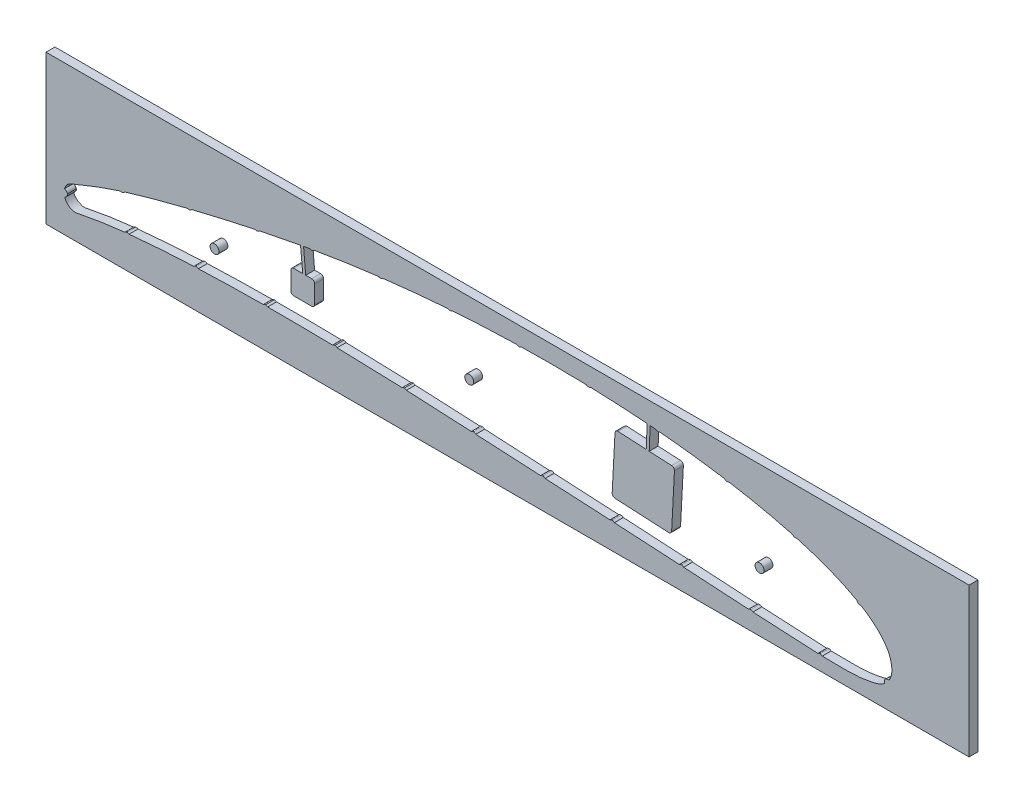
from build123d import *

# Parameters (mm, degrees)
BOSS_EXTRUDE1_DEPTH   = 3
BOSS_EXTRUDE2_START   = -3
BOSS_EXTRUDE2_DEPTH   = 3
SKETCH4_R             = 1.4999999999999973
BOSS_EXTRUDE3_DEPTH   = 3
SKETCH4_R_2           = 1.5000000000000042
BOSS_EXTRUDE3_2_DEPTH = 3
BOSS_EXTRUDE3_3_DEPTH = 3


# Read off the part's stored shape, not the designer's step: Boss-Extrude2
with BuildPart() as part:
    # Sketch1 → Boss-Extrude1 (new body)
    with BuildSketch(Plane.XY):
        Polygon((-280.0617418301615, 37.712423785622505), (29.938258169838473, 37.7124237856225), (29.938258169838473, -12.287576214377504), (-280.0617418301615, -12.287576214377504), align=None)
        with BuildLine():
            Line((-190.85404601252725, 16.42727857338892), (-192.85404601252725, 16.42727857338892))
            Line((-192.85404601252725, 16.42727857338892), (-193.56999025434837, 24.480551718674327))
            add(Edge.make_bspline(
                [(-78.16840229223553, 30.63963948980569), (-87.80030941925838, 31.39681210993548), (-107.13401239689482, 32.18560766949166), (-136.0930810232918, 31.481633705928775), (-164.9544487001638, 29.022939125560843), (-184.07172457220736, 26.20309686334219), (-193.56999025434837, 24.480551718674327)],
                knots=[1.6477548367984183, 1.6477548367984183, 1.6477548367984183, 1.6477548367984183, 1.6996663252520494, 1.7515778137056806, 1.8034893021593117, 1.8554007906129428, 1.8554007906129428, 1.8554007906129428, 1.8554007906129428], degree=3))
            Line((-78.16840229223553, 30.63963948980569), (-78.4845223782321, 22.97210189607874))
            Line((-78.4845223782321, 22.97210189607874), (-87.92724203547814, 23.466973863707263))
            ThreePointArc((-87.92724203547814, 23.466973863707263), (-88.64870859807996, 23.211489154430083), (-88.97820752647567, 22.520680285195617))
            Line((-88.97820752647567, 22.520680285195617), (-89.92025473884853, 4.545348659613297))
            ThreePointArc((-89.92025473884853, 4.545348659613297), (-89.66477002957134, 3.823882097011495), (-88.97396116033688, 3.494383168615778))
            Line((-88.97396116033688, 3.494383168615778), (-70.99862953475457, 2.5523359562429175))
            ThreePointArc((-70.99862953475457, 2.5523359562429175), (-70.27716297215275, 2.8078206655200972), (-69.94766404375704, 3.4986295347545613))
            Line((-69.94766404375704, 3.4986295347545613), (-69.00561683138419, 21.47396116033688))
            ThreePointArc((-69.00561683138419, 21.47396116033688), (-69.26110154066137, 22.195427722938685), (-69.95191040989583, 22.524926651334404))
            Line((-69.95191040989583, 22.524926651334404), (-77.4845223782321, 22.91969411679571))
            Line((-77.4845223782321, 22.91969411679571), (-77.16310914016181, 30.55927119660944))
            add(Edge.make_bspline(
                [(-194.5743095444694, 24.297269390822514), (-199.0748890517499, 23.470863661167208), (-205.81218343544447, 22.139157809968406), (-214.75288090409586, 20.223529664485483), (-221.44184547392086, 18.71753563279187), (-228.11693846055658, 17.14206305979209), (-234.77567096371374, 15.494484020866787), (-240.31508171522344, 14.05418905000995), (-244.73810418609548, 12.8534265772918), (-248.05215780318545, 11.926479525625448), (-251.3640208235326, 10.966189116297997), (-254.68649735568172, 9.959954418264767), (-257.45988509545435, 9.059228283146444), (-259.6716267225222, 8.293544814859066), (-261.33336410003346, 7.692530283221519), (-262.98230076620973, 7.070477522479272), (-264.33818764061704, 6.539016787168009), (-265.3953192907491, 6.114518853258316), (-266.1832796791735, 5.795988454908996), (-266.97496802169627, 5.47593747683827), (-267.65195977672204, 5.204859909516149), (-268.20628948332626, 4.98332878595608), (-268.6185029927296, 4.818019900431631), (-269.0225749894355, 4.6547236984236156), (-269.4122752051434, 4.495507264263548), (-269.7243657476736, 4.364985345125088), (-269.92309585994366, 4.2821706486608715), (-270.06076373007846, 4.2260210894879116), (-270.19701346339133, 4.172194247781482), (-270.32010101961635, 4.125477566910118), (-270.43002258555094, 4.085160419387649), (-270.51941636642897, 4.053100726716109), (-270.6171247260642, 4.018840772265524), (-270.72350598492636, 3.9823323762832925), (-270.8223781822498, 3.949161299520075), (-270.9136811926323, 3.9187853903684693), (-270.98441756859506, 3.8952682566444152), (-271.0568325003071, 3.871109210160312), (-271.11838393534987, 3.850397201137166), (-271.16951776098983, 3.832977249460483), (-271.2095694827856, 3.81918287874423), (-271.252580079772, 3.804152169023424), (-271.3007888879636, 3.78697811807259), (-271.358522686942, 3.7658383305933416), (-271.421390696716, 3.7419743664061893), (-271.49095631245234, 3.714203536040945), (-271.5583295787348, 3.6862228299848674), (-271.65057692934727, 3.6457521278101903), (-271.7632753497447, 3.5927551043819848), (-271.8973514066723, 3.523261462487154), (-272.0316486730558, 3.4479858053621113), (-272.21920562829763, 3.3324783950047716), (-272.4954821562871, 3.134573919883896), (-272.85931785098944, 2.822492809551407), (-273.2837762254473, 2.3100549258288705), (-273.6626243945065, 1.6839586524699874), (-274.0187116795929, 0.6541527094059202), (-274.0162602971361, -0.8703604662462496), (-273.3546225011884, -2.3343764565069676), (-272.4745363968785, -3.1948294470080008), (-271.75661576946095, -3.6147299051913437), (-271.05457494240915, -3.8817356495365187), (-270.53190733625905, -3.9722292542347484), (-270.1642868291065, -4.001044215917756), (-269.9283856239212, -4.001609075647538), (-269.765297648604, -3.9949407704258477), (-269.6068181202841, -3.982942324219433), (-269.4778581736112, -3.967902026239612), (-269.3745812943166, -3.9530110222631367), (-269.3004200420359, -3.9407564967247346), (-269.2435721303145, -3.930536688081123), (-269.1826924502828, -3.9188947999632857), (-269.12485023843107, -3.9070265924112095), (-269.0695158140851, -3.8950810045915367), (-269.0218688168142, -3.8844170850465796), (-268.96404119082587, -3.8711437137440523), (-268.8975836025596, -3.855456896794041), (-268.8205994085969, -3.836915433473535), (-268.74478919280375, -3.8184406861870017), (-268.6703879140166, -3.8002105622526745), (-268.5740015410013, -3.776574306036677), (-268.46717899002033, -3.7505705481462357), (-268.3488200669596, -3.7223586925498546), (-268.23880183797763, -3.6966651903242695), (-268.10233087941305, -3.665494967206004), (-267.94852603799256, -3.6316079123244216), (-267.7825546057743, -3.5967574407219995), (-267.62581626618567, -3.5653176155046133), (-267.46828775991787, -3.5348715184886412), (-267.2465807685956, -3.4930651573789486), (-266.9226341732447, -3.431922119663937), (-266.5214041731854, -3.354049432590619), (-266.10572327669064, -3.2726313443397763), (-265.5402011314822, -3.1616036682079907), (-264.8214238439404, -3.021611711934076), (-263.99367170737486, -2.867628602767552), (-263.1839732169304, -2.726103825311811), (-262.3830507382953, -2.5937667572254792), (-261.31781254569455, -2.426876736369115), (-259.9640305262372, -2.2281949909661), (-258.31294525393116, -2.002086295993872), (-256.6494474343612, -1.7901025551921959), (-254.98554574294013, -1.5927512671584272), (-252.76757245784253, -1.3477364853166023), (-249.987058348716, -1.0705881367590935), (-246.6336103841868, -0.7733760389183101), (-243.27270449029865, -0.509628046619367), (-238.78605580082444, -0.19864801214201266), (-233.16609331409865, 0.12061262145655369), (-226.40770416564095, 0.4099457957394287), (-219.6409974305319, 0.6172832021801229), (-210.60959601469463, 0.7958452189616317), (-199.30768541310152, 0.8552834373873816), (-185.7359143752275, 0.7083797596130299), (-172.15604567215414, 0.38097213388069745), (-158.58673324590427, -0.11710391005057878), (-145.0029011669094, -0.7723747117351506), (-131.3958455448103, -1.482797556251551), (-117.77735451369875, -2.197693634859276), (-104.16448083689467, -2.89327816853622), (-90.5643059170212, -3.615592446787772), (-76.96433147303938, -4.377332016687901), (-65.63288183697718, -5.040407740872196), (-56.563986209305334, -5.583697962569699), (-49.760516885635845, -5.992074850417291), (-42.95438613588708, -6.399782214151546), (-36.1389575058422, -6.795837307315924), (-30.45298061506581, -7.106644458306446), (-25.892695982787046, -7.332624670911473), (-22.463665767564862, -7.485779825138317), (-19.02113089300096, -7.612276652905124), (-15.549982104986235, -7.698666678535811), (-12.631902800294844, -7.71412412426893), (-10.256832898947584, -7.668057387737792), (-8.465050648208665, -7.59623202861059), (-6.601672963446198, -7.4683247757037545), (-4.6364057147132165, -7.223812352826307), (-3.216701323927118, -6.945941209187427), (-2.2864097099203073, -6.735317082701022), (-1.6945609127187742, -6.595138378681285), (-0.6839362442424346, -6.337658257128273), (0.6690111623862112, -5.7561977936554065), (1.787762078987277, -4.941451917304406), (2.547009172153864, -4.181714651685778), (3.2307351132803386, -3.234368940714876), (3.7636906379309925, -1.9927406687871774), (3.9742615993221575, -0.8806498869069416), (4.024538669451995, 0.37359905694986956), (3.9071257556829373, 1.4599571486406802), (3.634952651842351, 2.80041077741748), (3.1637804620331376, 4.117266957517159), (2.578275598026579, 5.270786237173809), (1.9470466000706335, 6.269428432436176), (1.0821118324543675, 7.45284803875332), (-0.09055921274926745, 8.7879648860098), (-1.5633301875628152, 10.184419433669486), (-3.620085613492676, 11.858695265092178), (-6.2491588857312115, 13.61158591285965), (-9.445794562628143, 15.418961559826556), (-12.72424494292546, 17.0078422711169), (-17.12699446216591, 18.871445873424623), (-22.66990731977071, 20.848839581091173), (-29.395963321820027, 22.84687381664959), (-36.15503451552397, 24.539683469092598), (-42.94830453573294, 25.992941200625584), (-52.03694604506786, 27.649250651173617), (-63.43772368587336, 29.27690283758347), (-72.5819677482583, 30.186902908935796), (-77.16310914016181, 30.55927119660944)],
                knots=[0.8572308268196556, 0.8572308268196556, 0.8572308268196556, 0.8572308268196556, 0.8818783191278569, 0.8942020652819576, 0.9065258114360581, 0.9188495575901588, 0.9311733037442596, 0.9434970498983601, 0.9496589229754104, 0.9558207960524608, 0.9619826691295112, 0.9681445422065615, 0.9743064152836118, 0.977387351822137, 0.9804682883606621, 0.9835492248991873, 0.9866301614377124, 0.988170629706975, 0.9897110979762376, 0.9912515662455001, 0.9927920345147628, 0.9935622686493941, 0.9943325027840255, 0.9951027369186568, 0.9958729710532881, 0.9966432051879194, 0.997028322255235, 0.9974134393225507, 0.9977985563898664, 0.998183673457182, 0.9983762319908398, 0.9985687905244975, 0.9987613490581554, 0.9989539075918132, 0.9991464661254711, 0.9992427453923001, 0.9993390246591289, 0.9994353039259578, 0.9995315831927867, 0.9995797228262011, 0.9996278624596155, 0.99967600209303, 0.9997241417264445, 0.9997722813598591, 0.9998204209932735, 0.9998444908099807, 0.9998685606266879, 0.9998926304433952, 0.9999167002601024, 0.999928735168456, 0.9999407700768096, 0.9999528049851631, 0.9999648398935168, 0.9999768748018705, 0.9999828922560472, 0.999988909710224, 0.9999949271644009, 1.0000009446185776, 1.0000069620727543, 1.0000129795269312, 1.0000189969811082, 1.000025014435285, 1.0000370493436384, 1.000049084251992, 1.0000611191603457, 1.0000731540686993, 1.000085188977053, 1.0001092587937601, 1.0001333286104672, 1.0001573984271745, 1.0001814682438819, 1.0002055380605892, 1.0002536776940036, 1.000301817327418, 1.0003499569608325, 1.000398096594247, 1.0004943758610758, 1.0005906551279047, 1.0006869343947336, 1.0007832136615624, 1.0008794929283915, 1.0010720514620495, 1.0012646099957072, 1.001457168529365, 1.0016497270630227, 1.0020348441303384, 1.002419961197654, 1.0028050782649696, 1.0031901953322853, 1.003575312399601, 1.0043455465342324, 1.0051157806688635, 1.0058860148034947, 1.006656248938126, 1.008196717207389, 1.0097371854766515, 1.011277653745914, 1.0128181220151766, 1.0143585902844392, 1.0174395268229643, 1.0205204633614895, 1.0236013999000146, 1.0266823364385398, 1.029763272977065, 1.0359251460541152, 1.0420870191311655, 1.0482488922082158, 1.0544107652852661, 1.0667345114393667, 1.0790582575934675, 1.0913820037475683, 1.103705749901669, 1.12835324220987, 1.1530007345180715, 1.177648226826273, 1.202295719134474, 1.2269432114426755, 1.2515907037508769, 1.276238196059078, 1.3008856883672795, 1.3255331806754809, 1.350180672983682, 1.3748281652918835, 1.3871519114459843, 1.3994756576000849, 1.4117994037541854, 1.424123149908286, 1.4364468960623866, 1.442608769139437, 1.4487706422164874, 1.454932515293538, 1.4610943883705882, 1.4672562614476385, 1.4703371979861637, 1.4734181345246888, 1.476499071063214, 1.4795800076017391, 1.4826609441402643, 1.4834311782748957, 1.4842014124095269, 1.4857418806787894, 1.487282348948052, 1.4880525830826832, 1.4888228172173146, 1.489593051351946, 1.4903632854865771, 1.4911335196212083, 1.4919037537558397, 1.4934442220251023, 1.4949846902943649, 1.4965251585636274, 1.49806562683289, 1.4996060951021526, 1.5011465633714152, 1.5042274999099403, 1.5073084364484655, 1.5103893729869906, 1.516551246064041, 1.5227131191410914, 1.528874992218142, 1.5350368652951922, 1.5473606114492928, 1.5596843576033934, 1.572008103757494, 1.5843318499115946, 1.5966555960656954, 1.6213030883738968, 1.645950580682098, 1.645950580682098, 1.645950580682098, 1.645950580682098], degree=3))
            Line((-194.5743095444694, 24.297269390822514), (-193.85404601252725, 16.42727857338892))
            Line((-193.85404601252725, 16.42727857338892), (-196.85404601252725, 16.42727857338892))
            ThreePointArc((-196.85404601252725, 16.42727857338892), (-197.5611527937138, 16.134385354575468), (-197.85404601252725, 15.427278573388922))
            Line((-197.85404601252725, 15.427278573388922), (-197.85404601252725, 9.427278573388922))
            ThreePointArc((-197.85404601252725, 9.427278573388922), (-197.5611527937138, 8.720171792202374), (-196.85404601252725, 8.427278573388923))
            Line((-196.85404601252725, 8.427278573388923), (-190.85404601252725, 8.427278573388923))
            ThreePointArc((-190.85404601252725, 8.427278573388923), (-190.1469392313407, 8.720171792202375), (-189.85404601252725, 9.427278573388923))
            Line((-189.85404601252725, 9.427278573388923), (-189.85404601252725, 15.427278573388923))
            ThreePointArc((-189.85404601252725, 15.427278573388923), (-190.1469392313407, 16.13438535457547), (-190.85404601252725, 16.42727857338892))
        make_face(mode=Mode.SUBTRACT)
    extrude(amount=BOSS_EXTRUDE1_DEPTH)

    # Boss-Extrude2 outline → Boss-Extrude2 (add)
    with BuildSketch(Plane.XY.offset(3).offset(BOSS_EXTRUDE2_START)):
        with BuildLine():
            add(Edge.make_bspline(
                [(-97.136387411, 31.674376095), (-97.61295371581214, 31.689297683779266), (-98.08953831274764, 31.703413237400653), (-98.566136175, 31.716728549)],
                knots=[1.681771325639394, 1.681771325639394, 1.681771325639394, 1.681771325639394, 1.684332397863202, 1.684332397863202, 1.684332397863202, 1.684332397863202], degree=3))
            add(Edge.make_bspline(
                [(-97.847927048, 31.447428217), (-97.9259799156616, 31.4538458937367), (-98.0784436882814, 31.4663817965373), (-98.2974989510406, 31.534969586956), (-98.45567951319626, 31.628367450091428), (-98.54071214162643, 31.695104419447198), (-98.566136175, 31.716728549)],
                knots=[0, 0, 0, 0, 0.127782842821096, 0.249603312684356, 0.371510054284345, 0.4260194405226241, 0.4260194405226241, 0.4260194405226241, 0.4260194405226241], degree=3))
            add(Edge.make_bspline(
                [(-97.136387411, 31.674376095), (-97.15713112005263, 31.658793773201168), (-97.23969457054474, 31.600838299650597), (-97.396358790293, 31.5193565414648), (-97.6167212479199, 31.4538698409591), (-97.7698782251484, 31.4496027351757), (-97.847927048, 31.447428217)],
                knots=[0.5858817165906655, 0.5858817165906655, 0.5858817165906655, 0.5858817165906655, 0.628236714499813, 0.750542171611453, 0.872876245996921, 1, 1, 1, 1], degree=3))
        make_face()
        with BuildLine():
            add(Edge.make_bspline(
                [(-120.402044887, 31.784854773), (-120.89917896158114, 31.774359356162932), (-121.39628330122622, 31.76305631895859), (-121.893356626, 31.750948678)],
                knots=[1.7234551334711954, 1.7234551334711954, 1.7234551334711954, 1.7234551334711954, 1.726128978492673, 1.726128978492673, 1.726128978492673, 1.726128978492673], degree=3))
            add(Edge.make_bspline(
                [(-121.142553557, 31.496137903), (-121.220513611376, 31.4986202182838), (-121.373244455174, 31.5034833002988), (-121.594641087973, 31.5644150399072), (-121.76544420173998, 31.654560669740558), (-121.86037661288606, 31.724072681645893), (-121.893356626, 31.750948678)],
                knots=[0, 0, 0, 0, 0.127392451639903, 0.249573408755608, 0.372137379215552, 0.4417011749006403, 0.4417011749006403, 0.4417011749006403, 0.4417011749006403], degree=3))
            add(Edge.make_bspline(
                [(-120.402044887, 31.784854773), (-120.43432271037392, 31.7560879596119), (-120.52626385315324, 31.68211795606394), (-120.69298165366, 31.5836792724373), (-120.912036916419, 31.5150914820185), (-121.064500689039, 31.502555579218), (-121.142553557, 31.496137903)],
                knots=[0.5578842902215215, 0.5578842902215215, 0.5578842902215215, 0.5578842902215215, 0.628489945715649, 0.750396687315643, 0.872217157178903, 1, 1, 1, 1], degree=3))
        make_face()
        with BuildLine():
            add(Edge.make_bspline(
                [(-143.681748191, 30.712185135), (-144.17626122385727, 30.67719243690044), (-144.67072113634944, 30.64142620360948), (-145.165125946, 30.604886066)],
                knots=[1.7652398965223384, 1.7652398965223384, 1.7652398965223384, 1.7652398965223384, 1.7679064066788306, 1.7679064066788306, 1.7679064066788306, 1.7679064066788306], degree=3))
            add(Edge.make_bspline(
                [(-144.401003061, 30.390339521), (-144.478869441089, 30.3877177175662), (-144.632743547676, 30.3825366932168), (-144.856964515504, 30.4368422498483), (-145.03354959779156, 30.515884881164585), (-145.13133467334663, 30.580112392625995), (-145.165125946, 30.604886066)],
                knots=[0, 0, 0, 0, 0.126566647868366, 0.25011217654809, 0.372266691438683, 0.44048751785488005, 0.44048751785488005, 0.44048751785488005, 0.44048751785488005], degree=3))
            add(Edge.make_bspline(
                [(-143.681748191, 30.712185135), (-143.71080687892407, 30.683906071661372), (-143.79742905411405, 30.607178066846288), (-143.956392417569, 30.5002457491828), (-144.172152344053, 30.420528136313), (-144.323750484409, 30.4005302177787), (-144.401003061, 30.390339521)],
                knots=[0.5625280684611026, 0.5625280684611026, 0.5625280684611026, 0.5625280684611026, 0.628628254765809, 0.75092837255123, 0.873076115111275, 1, 1, 1, 1], degree=3))
        make_face()
        with BuildLine():
            add(Edge.make_bspline(
                [(-166.893769233, 28.494517874), (-167.38675812602415, 28.43509979042218), (-167.87965991651163, 28.374897712125517), (-168.372470596, 28.313909265)],
                knots=[1.8070452791744163, 1.8070452791744163, 1.8070452791744163, 1.8070452791744163, 1.8097152136993053, 1.8097152136993053, 1.8097152136993053, 1.8097152136993053], degree=3))
            add(Edge.make_bspline(
                [(-167.595627005, 28.13337336), (-167.673257563184, 28.1285379962445), (-167.825749458881, 28.1190397550547), (-168.05308326513, 28.1561712133998), (-168.23335613926773, 28.230114513053685), (-168.33626984860075, 28.290125829224365), (-168.372470596, 28.313909265)],
                knots=[0, 0, 0, 0, 0.126824427288464, 0.249124801343794, 0.37251737669549, 0.44319859537325484, 0.44319859537325484, 0.44319859537325484, 0.44319859537325484], degree=3))
            add(Edge.make_bspline(
                [(-166.893769233, 28.494517874), (-166.92244483543138, 28.463365924159387), (-167.00566253960665, 28.381418868175363), (-167.159477780102, 28.2660815374787), (-167.369099328656, 28.1743220937326), (-167.519112601284, 28.1472046409218), (-167.595627005, 28.13337336)],
                knots=[0.560214236006466, 0.560214236006466, 0.560214236006466, 0.560214236006466, 0.629457859730139, 0.750995590744237, 0.872995078296341, 1, 1, 1, 1], degree=3))
        make_face()
        with BuildLine():
            add(Edge.make_bspline(
                [(-189.955621659, 25.120483613), (-189.9833334153857, 25.085759766961445), (-190.06274839784308, 24.996883807243123), (-190.217894516252, 24.879336924793), (-190.420231684646, 24.7729963796171), (-190.568991088299, 24.7390579962081), (-190.644910126, 24.721737616)],
                knots=[0.5556155818396276, 0.5556155818396276, 0.5556155818396276, 0.5556155818396276, 0.628320406023017, 0.750705447741691, 0.872773067903594, 1, 1, 1, 1], degree=3))
            add(Edge.make_bspline(
                [(-189.955621659, 25.120483613), (-190.44621075800563, 25.03572443525705), (-190.93664923108884, 24.95013972915232), (-191.426933037, 24.863727102)],
                knots=[1.8488213671958689, 1.8488213671958689, 1.8488213671958689, 1.8488213671958689, 1.8514984357921291, 1.8514984357921291, 1.8514984357921291, 1.8514984357921291], degree=3))
            add(Edge.make_bspline(
                [(-190.644910126, 24.721737616), (-190.722407106348, 24.7131566506311), (-190.873950177605, 24.696376824377), (-191.101904499436, 24.7222367153785), (-191.2852154424134, 24.78583374273427), (-191.3898352227602, 24.841507017909187), (-191.426933037, 24.863727102)],
                knots=[0, 0, 0, 0, 0.127553848187648, 0.249427808075142, 0.372548445681958, 0.4433552900996293, 0.4433552900996293, 0.4433552900996293, 0.4433552900996293], degree=3))
        make_face()
        with BuildLine():
            add(Edge.make_bspline(
                [(-208.418523105, 21.570264143), (-208.90591988518085, 21.468238612364758), (-209.39315131862327, 21.365660141141696), (-209.88022536, 21.262529998)],
                knots=[0.8825659275468849, 0.8825659275468849, 0.8825659275468849, 0.8825659275468849, 0.8852494460079405, 0.8852494460079405, 0.8852494460079405, 0.8852494460079405], degree=3))
            add(Edge.make_bspline(
                [(-209.091369974, 21.149010721), (-209.168779794244, 21.1373630581861), (-209.320650099682, 21.1145115123109), (-209.55014815359, 21.1361171239742), (-209.73584225383735, 21.191830209485673), (-209.8426326515424, 21.242278417431912), (-209.88022536, 21.262529998)],
                knots=[0, 0, 0, 0, 0.127082175794656, 0.249322485419255, 0.371648062466495, 0.4410602958550294, 0.4410602958550294, 0.4410602958550294, 0.4410602958550294], degree=3))
            add(Edge.make_bspline(
                [(-208.418523105, 21.570264143), (-208.44382124656593, 21.536805195838816), (-208.51899119366675, 21.44713838013116), (-208.666752889102, 21.3231154621555), (-208.866541551671, 21.2083609304335), (-209.015312792749, 21.1690882963112), (-209.091369974, 21.149010721)],
                knots=[0.5598196340876198, 0.5598196340876198, 0.5598196340876198, 0.5598196340876198, 0.628065151560934, 0.750197634553813, 0.872292093734125, 1, 1, 1, 1], degree=3))
        make_face()
        with BuildLine():
            add(Edge.make_bspline(
                [(-231.146011274, 16.389208346), (-231.6283120119689, 16.27006437783441), (-232.11050166323673, 16.150322158060554), (-232.592588638, 16.029966872)],
                knots=[0.9244568075424074, 0.9244568075424074, 0.9244568075424074, 0.9244568075424074, 0.92713418202752, 0.92713418202752, 0.92713418202752, 0.92713418202752], degree=3))
            add(Edge.make_bspline(
                [(-231.804440009, 15.94870586), (-231.880771646825, 15.9330685089663), (-232.030746478438, 15.9023445624497), (-232.260364214307, 15.9167299757324), (-232.44778114649284, 15.963622163785864), (-232.55515372430764, 16.011054061285428), (-232.592588638, 16.029966872)],
                knots=[0, 0, 0, 0, 0.126623505446785, 0.248787259717305, 0.371596684215639, 0.4398977247786833, 0.4398977247786833, 0.4398977247786833, 0.4398977247786833], degree=3))
            add(Edge.make_bspline(
                [(-231.146011274, 16.389208346), (-231.17019469384877, 16.35502056021889), (-231.24249673822163, 16.26323571193985), (-231.385144590859, 16.1335837600601), (-231.581803743428, 16.0138987946396), (-231.729260042278, 15.9707202551747), (-231.804440009, 15.94870586)],
                knots=[0.5604601976170126, 0.5604601976170126, 0.5604601976170126, 0.5604601976170126, 0.62859830452586, 0.750475750894662, 0.872781122356896, 1, 1, 1, 1], degree=3))
        make_face()
        with BuildLine():
            add(Edge.make_bspline(
                [(-253.632077556, 10.275199234), (-253.98374956915166, 10.16712284712126), (-254.4667022344429, 10.017240924056846), (-254.94983182636096, 9.864996182824086), (-255.08104751, 9.823471079)],
                knots=[0.9661883584369809, 0.9661883584369809, 0.9661883584369809, 0.9661883584369809, 0.968144542206562, 0.9688738723966996, 0.9688738723966996, 0.9688738723966996, 0.9688738723966996], degree=3))
            add(Edge.make_bspline(
                [(-254.269328358, 9.779733172), (-254.344496696283, 9.75955209807818), (-254.492143149146, 9.71991221784498), (-254.722372112337, 9.71869011937871), (-254.91895136917324, 9.759143032327652), (-255.03590023340217, 9.803340652955304), (-255.08104751, 9.823471079)],
                knots=[0, 0, 0, 0, 0.126756561465877, 0.248976592832816, 0.37210972039602, 0.45275644150048355, 0.45275644150048355, 0.45275644150048355, 0.45275644150048355], degree=3))
            add(Edge.make_bspline(
                [(-253.632077556, 10.275199234), (-253.6570120431113, 10.23367409868002), (-253.72585174232398, 10.132163736332037), (-253.864006469393, 9.98988121940454), (-254.051945760047, 9.8590748222205), (-254.195838238706, 9.80655605178704), (-254.269328358, 9.779733172)],
                knots=[0.5503367590470254, 0.5503367590470254, 0.5503367590470254, 0.5503367590470254, 0.629378035023054, 0.750448308026975, 0.872546613545376, 1, 1, 1, 1], degree=3))
        make_face()
        with BuildLine():
            add(Edge.make_bspline(
                [(-273.8592452, 1.058223698), (-273.90005124773444, 0.9094113494517186), (-274.01823216018676, 0.3559398985984736), (-274.0168724912144, -0.48963736208441516), (-273.8439682313241, -1.1094817941529422), (-273.803547579, -1.231704773)],
                knots=[0.9999924409658777, 0.9999924409658777, 0.9999924409658777, 0.9999924409658777, 0.999994927164401, 1.00000094461858, 1.0000024537801304, 1.0000024537801304, 1.0000024537801304, 1.0000024537801304], degree=3))
            add(Edge.make_bspline(
                [(-272.879868761, 0.055492793), (-272.873836698747, -0.0221355412146379), (-272.861989857141, -0.174595933412285), (-272.900120004113, -0.401907453965553), (-272.986687285455, -0.614630513324422), (-273.113195403942, -0.809601365213865), (-273.269909687755, -0.980518615501814), (-273.458042763639, -1.11200154915021), (-273.6385693165876, -1.1950564494587177), (-273.75773917345896, -1.2226037204814904), (-273.803547579, -1.231704773)],
                knots=[0, 0, 0, 0, 0.12694988369067, 0.249326862427979, 0.372796726578387, 0.499994819844512, 0.627605522894743, 0.749322060258416, 0.873169797868121, 0.9494091925942163, 0.9494091925942163, 0.9494091925942163, 0.9494091925942163], degree=3))
            add(Edge.make_bspline(
                [(-273.8592452, 1.058223698), (-273.81654026152023, 1.051845462304401), (-273.7014046745361, 1.0272209803434271), (-273.517152971225, 0.958182424753495), (-273.3218378415, 0.832551205610876), (-273.152051205025, 0.674378780196078), (-273.016009465324, 0.490947353131219), (-272.920079663311, 0.282758293793162), (-272.893428374837, 0.132129532109247), (-272.879868761, 0.055492793)],
                knots=[0.18064310513091356, 0.18064310513091356, 0.18064310513091356, 0.18064310513091356, 0.251206314764848, 0.372321806929586, 0.500998339129022, 0.628797770286969, 0.750347802189032, 0.872982224071579, 1, 1, 1, 1], degree=3))
        make_face()
        with BuildLine():
            add(Edge.make_bspline(
                [(-253.605161581, -1.441416738), (-253.51063105189013, -1.4311975854204135), (-253.0324602603461, -1.3798052428253549), (-252.5538911357192, -1.32985428037125), (-252.169660259, -1.290630022)],
                knots=[1.0292383835791172, 1.0292383835791172, 1.0292383835791172, 1.0292383835791172, 1.02976327297706, 1.031893117530192, 1.031893117530192, 1.031893117530192, 1.031893117530192], degree=3))
            add(Edge.make_bspline(
                [(-252.914892582, -1.112408146), (-252.837181169717, -1.10823418215935), (-252.684187428851, -1.10001672245455), (-252.459025892361, -1.14375442052538), (-252.28997998690707, -1.2162818778580218), (-252.1976443845446, -1.2720912523390975), (-252.169660259, -1.290630022)],
                knots=[0, 0, 0, 0, 0.127054460462842, 0.250137483808484, 0.371533833523254, 0.42641602707033427, 0.42641602707033427, 0.42641602707033427, 0.42641602707033427], degree=3))
            add(Edge.make_bspline(
                [(-253.605161581, -1.441416738), (-253.58167145508293, -1.4176880836117904), (-253.50217534687175, -1.3435417716787963), (-253.351526147522, -1.23830443801319), (-253.14161778621, -1.14686695142176), (-252.991474207453, -1.12404739621611), (-252.914892582, -1.112408146)],
                knots=[0.5735997485120303, 0.5735997485120303, 0.5735997485120303, 0.5735997485120303, 0.628320677175065, 0.751714188845252, 0.873360345578502, 1, 1, 1, 1], degree=3))
        make_face()
        with BuildLine():
            add(Edge.make_bspline(
                [(-230.434519304, 0.23331898), (-229.921796247256, 0.2560308503321542), (-229.40896985779023, 0.27797378439406045), (-228.896052164, 0.299170956)],
                knots=[1.0717143702336078, 1.0717143702336078, 1.0717143702336078, 1.0717143702336078, 1.0745199635773452, 1.0745199635773452, 1.0745199635773452, 1.0745199635773452], degree=3))
            add(Edge.make_bspline(
                [(-229.661922006, 0.561354145), (-229.583922738289, 0.56009966654291), (-229.43105558782, 0.55764107327452), (-229.209297419993, 0.494981887662709), (-229.03200896392207, 0.403987929413702), (-228.93274256244638, 0.32993763851118835), (-228.896052164, 0.299170956)],
                knots=[0, 0, 0, 0, 0.127014630790295, 0.248930089964494, 0.372584368106906, 0.4506853228629117, 0.4506853228629117, 0.4506853228629117, 0.4506853228629117], degree=3))
            add(Edge.make_bspline(
                [(-230.434519304, 0.23331898), (-230.39283669221845, 0.27474326584868114), (-230.2912729117171, 0.36348575426542457), (-230.109991401269, 0.469120191221674), (-229.892257735516, 0.543699612452009), (-229.740117099818, 0.555360728751028), (-229.661922006, 0.561354145)],
                knots=[0.5318770156379437, 0.5318770156379437, 0.5318770156379437, 0.5318770156379437, 0.627656645884799, 0.751562124869786, 0.872311411636283, 1, 1, 1, 1], degree=3))
        make_face()
        with BuildLine():
            add(Edge.make_bspline(
                [(-207.080821604, 0.803347375), (-206.59381676698717, 0.8067411663594959), (-206.10678164001635, 0.8096641445306254), (-205.619718469, 0.81212544)],
                knots=[1.114225320413259, 1.114225320413259, 1.114225320413259, 1.114225320413259, 1.116880984046625, 1.116880984046625, 1.116880984046625, 1.116880984046625], degree=3))
            add(Edge.make_bspline(
                [(-206.350359251, 1.069739514), (-206.272434802818, 1.06504038554307), (-206.11967303196, 1.0558282932195), (-205.897759474988, 0.994345812822027), (-205.7361336906853, 0.9009410986089611), (-205.6473630574855, 0.8346099163457625), (-205.619718469, 0.81212544)],
                knots=[0, 0, 0, 0, 0.127564391899991, 0.250075076958219, 0.372662152162646, 0.43089689497973693, 0.43089689497973693, 0.43089689497973693, 0.43089689497973693], degree=3))
            add(Edge.make_bspline(
                [(-207.080821604, 0.803347375), (-207.05243505895191, 0.8271054668471114), (-206.96339827916114, 0.8951509810831006), (-206.799711241052, 0.986329358430335), (-206.581360923286, 1.05801792051578), (-206.428511125504, 1.06577389563211), (-206.350359251, 1.069739514)],
                knots=[0.5680014811692338, 0.5680014811692338, 0.5680014811692338, 0.5680014811692338, 0.628418465259644, 0.750841937945432, 0.872605853256528, 1, 1, 1, 1], degree=3))
        make_face()
        with BuildLine():
            add(Edge.make_bspline(
                [(-183.834857096, 0.643348432), (-183.3176256952967, 0.633354998715646), (-182.80038234782415, 0.6229715960827177), (-182.283131695, 0.612200671)],
                knots=[1.15644960807312, 1.15644960807312, 1.15644960807312, 1.15644960807312, 1.1592665792656067, 1.1592665792656067, 1.1592665792656067, 1.1592665792656067], degree=3))
            add(Edge.make_bspline(
                [(-183.03593857, 0.92647452), (-182.95780128968, 0.919256435472326), (-182.805883901501, 0.905222768318677), (-182.588314284846, 0.832373714077097), (-182.41584521573222, 0.7290459996852132), (-182.31982355917373, 0.6473199517992176), (-182.283131695, 0.612200671)],
                knots=[0, 0, 0, 0, 0.127987356291147, 0.248837749569901, 0.371530363654609, 0.45444879452205483, 0.45444879452205483, 0.45444879452205483, 0.45444879452205483], degree=3))
            add(Edge.make_bspline(
                [(-183.834857096, 0.643348432), (-183.78833346927144, 0.6844282820859345), (-183.67878592554683, 0.7679376926922031), (-183.48831785498, 0.863224698760973), (-183.266398658943, 0.922020526375958), (-183.113882033068, 0.924968143512184), (-183.03593857, 0.92647452)],
                knots=[0.5272230389604384, 0.5272230389604384, 0.5272230389604384, 0.5272230389604384, 0.628434402092807, 0.751419479671922, 0.87296318287285, 1, 1, 1, 1], degree=3))
        make_face()
        with BuildLine():
            add(Edge.make_bspline(
                [(-160.446566047, -0.06568212), (-159.9784977780695, -0.0848182963598359), (-159.51040974943865, -0.10423810554298402), (-159.042297335, -0.123939062)],
                knots=[1.198914677107866, 1.198914677107866, 1.198914677107866, 1.198914677107866, 1.2014642605483015, 1.2014642605483015, 1.2014642605483015, 1.2014642605483015], degree=3))
            add(Edge.make_bspline(
                [(-159.741787404, 0.142106423), (-159.663650123655, 0.134888338142483), (-159.511732735476, 0.120854670988833), (-159.294163118821, 0.0480056167472528), (-159.14237087157122, -0.04293443442436277), (-159.06268490289236, -0.10653791157396875), (-159.042297335, -0.123939062)],
                knots=[0, 0, 0, 0, 0.127987356291147, 0.248837749569901, 0.371530363654609, 0.41531026934505344, 0.41531026934505344, 0.41531026934505344, 0.41531026934505344], degree=3))
            add(Edge.make_bspline(
                [(-160.446566047, -0.06568212), (-160.4288748193195, -0.05292635558310028), (-160.34849315979483, 0.0016504465111828), (-160.194166688955, 0.0788566014311291), (-159.972247492918, 0.137652429046114), (-159.819730867043, 0.14060004618234), (-159.741787404, 0.142106423)],
                knots=[0.5928277455847756, 0.5928277455847756, 0.5928277455847756, 0.5928277455847756, 0.628434402092806, 0.751419479671922, 0.87296318287285, 1, 1, 1, 1], degree=3))
        make_face()
        with BuildLine():
            add(Edge.make_bspline(
                [(-137.236290314, -1.178699821), (-136.72980424748084, -1.2049819097286127), (-136.22328389699783, -1.231318508915331), (-135.716731999, -1.257697857)],
                knots=[1.2410102665863674, 1.2410102665863674, 1.2410102665863674, 1.2410102665863674, 1.2437626326065714, 1.2437626326065714, 1.2437626326065714, 1.2437626326065714], degree=3))
            add(Edge.make_bspline(
                [(-136.454490165, -0.933886585), (-136.377139884928, -0.941746439816545), (-136.224193630305, -0.957287887309813), (-136.009514997868, -1.03872468891116), (-135.84162822544417, -1.1437969257857734), (-135.7504078237397, -1.2242979249756392), (-135.716731999, -1.257697857)],
                knots=[0, 0, 0, 0, 0.126595037289195, 0.250318896319419, 0.371113004598758, 0.448469583215603, 0.448469583215603, 0.448469583215603, 0.448469583215603], degree=3))
            add(Edge.make_bspline(
                [(-137.236290314, -1.178699821), (-137.1962180880537, -1.146977412306718), (-137.09227099859436, -1.0739706911627318), (-136.909796423955, -0.984988279659699), (-136.685148502163, -0.933224520679115), (-136.532314626261, -0.933663203681073), (-136.454490165, -0.933886585)],
                knots=[0.5439979483735052, 0.5439979483735052, 0.5439979483735052, 0.5439979483735052, 0.627353660942562, 0.750963134980005, 0.873188063375038, 1, 1, 1, 1], degree=3))
        make_face()
        with BuildLine():
            add(Edge.make_bspline(
                [(-113.962864278, -2.391522891), (-113.4549778347411, -2.4176985953961805), (-112.94710726145865, -2.443860919852197), (-112.439254213, -2.470020622)],
                knots=[1.2831454349966838, 1.2831454349966838, 1.2831454349966838, 1.2831454349966838, 1.2859039813743467, 1.2859039813743467, 1.2859039813743467, 1.2859039813743467], degree=3))
            add(Edge.make_bspline(
                [(-113.178531649, -2.144699884), (-113.101181368419, -2.15255973816141), (-112.948235113795, -2.16810118565468), (-112.733556481359, -2.24953798725603), (-112.56506241568233, -2.3549902996993684), (-112.47337772560061, -2.4360577980789206), (-112.439254213, -2.470020622)],
                knots=[0, 0, 0, 0, 0.126595037289188, 0.250318896319414, 0.371113004598754, 0.44963389316790275, 0.44963389316790275, 0.44963389316790275, 0.44963389316790275], degree=3))
            add(Edge.make_bspline(
                [(-113.962864278, -2.391522891), (-113.92202431054503, -2.35903194273924), (-113.81728675864491, -2.285259088451728), (-113.633837907446, -2.19580157800455), (-113.409189985654, -2.14403781902398), (-113.256356109752, -2.14447650202594), (-113.178531649, -2.144699884)],
                knots=[0.5422403215187932, 0.5422403215187932, 0.5422403215187932, 0.5422403215187932, 0.627353660942562, 0.750963134979991, 0.873188063375031, 1, 1, 1, 1], degree=3))
        make_face()
        with BuildLine():
            add(Edge.make_bspline(
                [(-90.673235562, -3.616223159), (-90.63693681511958, -3.618202794753549), (-90.13685302630012, -3.6454818126463184), (-89.63676964407031, -3.672840789858455), (-89.172985689, -3.698281703)],
                knots=[1.3253358274307443, 1.3253358274307443, 1.3253358274307443, 1.3253358274307443, 1.32553318067548, 1.3280547413115675, 1.3280547413115675, 1.3280547413115675, 1.3280547413115675], degree=3))
            add(Edge.make_bspline(
                [(-89.903927195, -3.381178376), (-89.8265769145361, -3.38903823036306), (-89.673630659913, -3.40457967785633), (-89.4589520274766, -3.48601647945768), (-89.29377723249566, -3.589391420397756), (-89.20464041891915, -3.667375944511874), (-89.172985689, -3.698281703)],
                knots=[0, 0, 0, 0, 0.126595037289188, 0.250318896319414, 0.371113004598754, 0.44327014733717773, 0.44327014733717773, 0.44327014733717773, 0.44327014733717773], degree=3))
            add(Edge.make_bspline(
                [(-90.673235562, -3.616223159), (-90.63697603887266, -3.5882162393656736), (-90.5369289143747, -3.518931981286788), (-90.3592334535632, -3.43228007020621), (-90.1345855317712, -3.38051631122563), (-89.9817516558692, -3.38095499422759), (-89.903927195, -3.381178376)],
                knots=[0.5526196264009142, 0.5526196264009142, 0.5526196264009142, 0.5526196264009142, 0.627353660942562, 0.750963134979991, 0.873188063375031, 1, 1, 1, 1], degree=3))
        make_face()
        with BuildLine():
            add(Edge.make_bspline(
                [(-67.385232716, -4.939482553), (-66.89483241491237, -4.968350991720153), (-66.40442313611875, -4.997274257597477), (-65.914002832, -5.026250601)],
                knots=[1.3675431375132416, 1.3675431375132416, 1.3675431375132416, 1.3675431375132416, 1.3702094784517025, 1.3702094784517025, 1.3702094784517025, 1.3702094784517025], degree=3))
            add(Edge.make_bspline(
                [(-66.634911495, -4.718830409), (-66.5575612151137, -4.72669026387603), (-66.4046149604905, -4.7422317113693), (-66.1899363280542, -4.82366851297065), (-66.02871577096346, -4.924568687052862), (-65.94264690407107, -4.998923059817697), (-65.914002832, -5.026250601)],
                knots=[0, 0, 0, 0, 0.126595037289188, 0.250318896319414, 0.371113004598755, 0.4356890347394082, 0.4356890347394082, 0.4356890347394082, 0.4356890347394082], degree=3))
            add(Edge.make_bspline(
                [(-67.385232716, -4.939482553), (-67.35484794724692, -4.916883834720962), (-67.26073163564163, -4.853081969395796), (-67.0902177541408, -4.76993210371918), (-66.8655698323487, -4.7181683447386), (-66.7127359564467, -4.71860702774056), (-66.634911495, -4.718830409)],
                knots=[0.565575430922253, 0.565575430922253, 0.565575430922253, 0.565575430922253, 0.627353660942562, 0.750963134979991, 0.873188063375031, 1, 1, 1, 1], degree=3))
        make_face()
        with BuildLine():
            add(Edge.make_bspline(
                [(-44.120702201, -6.328758486), (-43.73145548570962, -6.351836673823579), (-43.24003066319006, -6.380909496620831), (-42.748533213787496, -6.409891302103973), (-42.646376894, -6.415910797)],
                knots=[1.4096859751270228, 1.4096859751270228, 1.4096859751270228, 1.4096859751270228, 1.41179940375419, 1.4123539092195005, 1.4123539092195005, 1.4123539092195005, 1.4123539092195005], degree=3))
            add(Edge.make_bspline(
                [(-43.368867289, -6.106978823), (-43.2915170088929, -6.1148386771977), (-43.1385707542698, -6.13038012469097), (-42.9238921218335, -6.21181692629232), (-42.76205104925952, -6.313105451099789), (-42.67549839773271, -6.388026419280779), (-42.646376894, -6.415910797)],
                knots=[0, 0, 0, 0, 0.126595037289188, 0.250318896319418, 0.371113004598758, 0.43687869451127104, 0.43687869451127104, 0.43687869451127104, 0.43687869451127104], degree=3))
            add(Edge.make_bspline(
                [(-44.120702201, -6.328758486), (-44.089845653801916, -6.305739164688802), (-43.99525639165119, -6.2415078330494005), (-43.82417354792, -6.15808051704085), (-43.599525626128, -6.10631675806027), (-43.446691750226, -6.10675544106223), (-43.368867289, -6.106978823)],
                knots=[0.5645490044056627, 0.5645490044056627, 0.5645490044056627, 0.5645490044056627, 0.627353660942559, 0.750963134979992, 0.873188063375031, 1, 1, 1, 1], degree=3))
        make_face()
        with BuildLine():
            add(Edge.make_bspline(
                [(-20.856323408, -7.543458309), (-20.35786225710248, -7.561684695008419), (-19.858755114404666, -7.578876072499704), (-19.358795793, -7.594848918)],
                knots=[1.4516461829197629, 1.4516461829197629, 1.4516461829197629, 1.4516461829197629, 1.4543218756073335, 1.4543218756073335, 1.4543218756073335, 1.4543218756073335], degree=3))
            add(Edge.make_bspline(
                [(-20.097261746, -7.294094039), (-20.0191244663392, -7.30131212345565), (-19.8672070781601, -7.3153457906093), (-19.6496374615049, -7.38819484485087), (-19.482834903533607, -7.488127703295953), (-19.3911992186131, -7.564767223046629), (-19.358795793, -7.594848918)],
                knots=[0, 0, 0, 0, 0.12798735629114, 0.248837749569899, 0.371530363654609, 0.4437228284876441, 0.4437228284876441, 0.4437228284876441, 0.4437228284876441], degree=3))
            add(Edge.make_bspline(
                [(-20.856323408, -7.543458309), (-20.82167686935524, -7.515330351526333), (-20.724462477363836, -7.444803202355722), (-20.5496410316387, -7.35734386016701), (-20.3277218356023, -7.29854803255201), (-20.1752052097272, -7.29560041541579), (-20.097261746, -7.294094039)],
                knots=[0.5556249979267169, 0.5556249979267169, 0.5556249979267169, 0.5556249979267169, 0.628434402092807, 0.751419479671924, 0.872963182872841, 1, 1, 1, 1], degree=3))
        make_face()
        with BuildLine():
            add(Edge.make_bspline(
                [(1.615052198, -5.049220728), (1.6686236242422294, -5.006028605978126), (1.990816087633514, -4.738266816313915), (2.4882371944702575, -4.240524572753918), (2.8962956410271414, -3.695129329364654), (3.060426629, -3.431776341)],
                knots=[1.4879003261390373, 1.4879003261390373, 1.4879003261390373, 1.4879003261390373, 1.48805258308268, 1.48882281721731, 1.4894141839564239, 1.4894141839564239, 1.4894141839564239, 1.4894141839564239], degree=3))
            add(Edge.make_bspline(
                [(1.746184402, -3.776934394), (1.79812546236242, -3.71928613160094), (1.8998652732362, -3.60636731084839), (2.09059989423616, -3.48084222519213), (2.30300798059378, -3.39868033555567), (2.53141251539381, -3.35784992520743), (2.76345488675686, -3.35696429216847), (2.940171951075496, -3.3905342388185833), (3.0358640983624974, -3.422512574402773), (3.060426629, -3.431776341)],
                knots=[0, 0, 0, 0, 0.127045618832458, 0.248851238000167, 0.370898602372884, 0.498905721193805, 0.627894595550799, 0.749864653588366, 0.7928362115552984, 0.7928362115552984, 0.7928362115552984, 0.7928362115552984], degree=3))
            add(Edge.make_bspline(
                [(1.615052198, -5.049220728), (1.5841308646511596, -4.988268255619847), (1.529527730205276, -4.851698669208959), (1.48362005924657, -4.63015106424497), (1.47966923153134, -4.39733572085074), (1.52409768588528, -4.17323984586912), (1.60626113431678, -3.95981448681306), (1.69900834696706, -3.83859362648646), (1.746184402, -3.776934394)],
                knots=[0.25984965285066813, 0.25984965285066813, 0.25984965285066813, 0.25984965285066813, 0.371696517880244, 0.500126180043855, 0.628958100107001, 0.750771112812112, 0.873229229174842, 1, 1, 1, 1], degree=3))
        make_face()
        with BuildLine():
            add(Edge.make_bspline(
                [(-6.378209791, 13.637176555), (-6.835166424368261, 13.916766813042692), (-7.293466019236034, 14.187263591800477), (-7.753644878, 14.449705555)],
                knots=[1.5167880802285383, 1.5167880802285383, 1.5167880802285383, 1.5167880802285383, 1.5194465862392463, 1.5194465862392463, 1.5194465862392463, 1.5194465862392463], degree=3))
            add(Edge.make_bspline(
                [(-7.224249155, 13.763748535), (-7.28870216197991, 13.8062680007457), (-7.41566219332999, 13.8900231722563), (-7.57373818626418, 14.0561038607861), (-7.684570625631088, 14.246791428773111), (-7.735147931301556, 14.38280054323406), (-7.753644878, 14.449705555)],
                knots=[0, 0, 0, 0, 0.126300348125117, 0.248787400731924, 0.371781450217686, 0.4854592858633565, 0.4854592858633565, 0.4854592858633565, 0.4854592858633565], degree=3))
            add(Edge.make_bspline(
                [(-6.378209791, 13.637176555), (-6.442410464287708, 13.621821441710008), (-6.5811024046159705, 13.599922337270765), (-6.79718611092733, 13.6044670944052), (-7.01960622059316, 13.6578151653919), (-7.15534552180621, 13.7280805847901), (-7.224249155, 13.763748535)],
                knots=[0.520414729501057, 0.520414729501057, 0.520414729501057, 0.520414729501057, 0.628573356302727, 0.749827580159995, 0.873008123544508, 1, 1, 1, 1], degree=3))
        make_face()
        with BuildLine():
            add(Edge.make_bspline(
                [(-27.999871681, 22.405471682), (-28.450161205171593, 22.533201995082493), (-28.90073005106497, 22.65878856415352), (-29.351522341, 22.782325018)],
                knots=[1.5571211694773452, 1.5571211694773452, 1.5571211694773452, 1.5571211694773452, 1.5595930714983293, 1.5595930714983293, 1.5595930714983293, 1.5595930714983293], degree=3))
            add(Edge.make_bspline(
                [(-28.718931822, 22.360886839), (-28.7931060155622, 22.3840372798546), (-28.9395784861025, 22.4297526705538), (-29.1356954542493, 22.5504646864992), (-29.266600282585156, 22.676293064873168), (-29.33316607384177, 22.75801481616164), (-29.351522341, 22.782325018)],
                knots=[0, 0, 0, 0, 0.126266134390831, 0.24933891125644, 0.371122336763787, 0.420686179544175, 0.420686179544175, 0.420686179544175, 0.420686179544175], degree=3))
            add(Edge.make_bspline(
                [(-27.999871681, 22.405471682), (-28.014160666313614, 22.399693728527357), (-28.09899253017671, 22.367201328744642), (-28.2599799310521, 22.324768308909), (-28.4908510462129, 22.3157275823465), (-28.6416926359737, 22.3455937298639), (-28.718931822, 22.360886839)],
                knots=[0.603163667356416, 0.603163667356416, 0.603163667356416, 0.603163667356416, 0.628183049876769, 0.75059095458944, 0.872288858119289, 1, 1, 1, 1], degree=3))
        make_face()
        with BuildLine():
            add(Edge.make_bspline(
                [(-50.694273078, 27.360686936), (-51.191152371134315, 27.44291841084228), (-51.68815488476758, 27.52375880073369), (-52.185274431, 27.603234175)],
                knots=[1.5983290028808288, 1.5983290028808288, 1.5983290028808288, 1.5983290028808288, 1.601019976909145, 1.601019976909145, 1.601019976909145, 1.601019976909145], degree=3))
            add(Edge.make_bspline(
                [(-51.48171728, 27.205560888), (-51.5584178895944, 27.2220572881924), (-51.7084993757584, 27.2543360959379), (-51.9161939474074, 27.3564968774228), (-52.07132545257829, 27.479235707980912), (-52.15554026017281, 27.568034845005617), (-52.185274431, 27.603234175)],
                knots=[0, 0, 0, 0, 0.127114080393788, 0.248726447686077, 0.372100244465021, 0.4468620766618493, 0.4468620766618493, 0.4468620766618493, 0.4468620766618493], degree=3))
            add(Edge.make_bspline(
                [(-50.694273078, 27.360686936), (-50.733026932569985, 27.33673610644927), (-50.838700667879785, 27.279116590306195), (-51.0232147536053, 27.2108569577531), (-51.2515338854859, 27.1831233411991), (-51.4042039783284, 27.1980051374797), (-51.48171728, 27.205560888)],
                knots=[0.5552392179254474, 0.5552392179254474, 0.5552392179254474, 0.5552392179254474, 0.629329842113244, 0.750679616193133, 0.873415638746843, 1, 1, 1, 1], degree=3))
        make_face()
        with BuildLine():
            add(Edge.make_bspline(
                [(-73.880501866, 30.277964112), (-73.89704821816184, 30.267201306897878), (-73.97700293370862, 30.217983637446363), (-74.1318349780616, 30.1469648966665), (-74.3554862576763, 30.0934232444061), (-74.5093239398934, 30.0985274417059), (-74.587171888, 30.101110367)],
                knots=[0.5967402641126208, 0.5967402641126208, 0.5967402641126208, 0.5967402641126208, 0.628911011501458, 0.749746149719041, 0.873361659622674, 1, 1, 1, 1], degree=3))
            add(Edge.make_bspline(
                [(-73.880501866, 30.277964112), (-74.34933600108236, 30.320241942204238), (-74.81825696339016, 30.361614158368834), (-75.2872681, 30.40209731)],
                knots=[1.6400608496463565, 1.6400608496463565, 1.6400608496463565, 1.6400608496463565, 1.6425855522446378, 1.6425855522446378, 1.6425855522446378, 1.6425855522446378], degree=3))
            add(Edge.make_bspline(
                [(-74.587171888, 30.101110367), (-74.6646080962285, 30.1109031766498), (-74.8168972476433, 30.13016210811), (-75.0305747692572, 30.2159226107264), (-75.18520765810963, 30.311789211208474), (-75.26508846535562, 30.381174726027787), (-75.2872681, 30.40209731)],
                knots=[0, 0, 0, 0, 0.126593213445295, 0.248963288682694, 0.371399584057659, 0.4209638686104612, 0.4209638686104612, 0.4209638686104612, 0.4209638686104612], degree=3))
        make_face()
    extrude(amount=BOSS_EXTRUDE2_DEPTH)


with BuildPart() as body_2:
    # Sketch4 → Boss-Extrude3 (new body)
    with BuildSketch(Plane.XY.offset(3)):
        with Locations((-223.47350115183855, 8.778013841253006)):
            Circle(SKETCH4_R)
    extrude(amount=-BOSS_EXTRUDE3_DEPTH)


with BuildPart() as body_3:
    # Sketch4 → Boss-Extrude3 2 (new body)
    with BuildSketch(Plane.XY.offset(3)):
        with Locations((-40.429021084711245, 7.507418928729218)):
            Circle(SKETCH4_R_2)
    extrude(amount=-BOSS_EXTRUDE3_2_DEPTH)


with BuildPart() as body_4:
    # Sketch4 → Boss-Extrude3 3 (new body)
    with BuildSketch(Plane.XY.offset(3)):
        with Locations((-137.9332107755678, 13.567001338895441)):
            Circle(SKETCH4_R)
    extrude(amount=-BOSS_EXTRUDE3_3_DEPTH)


solid = Compound([part.part, body_2.part, body_3.part, body_4.part])
